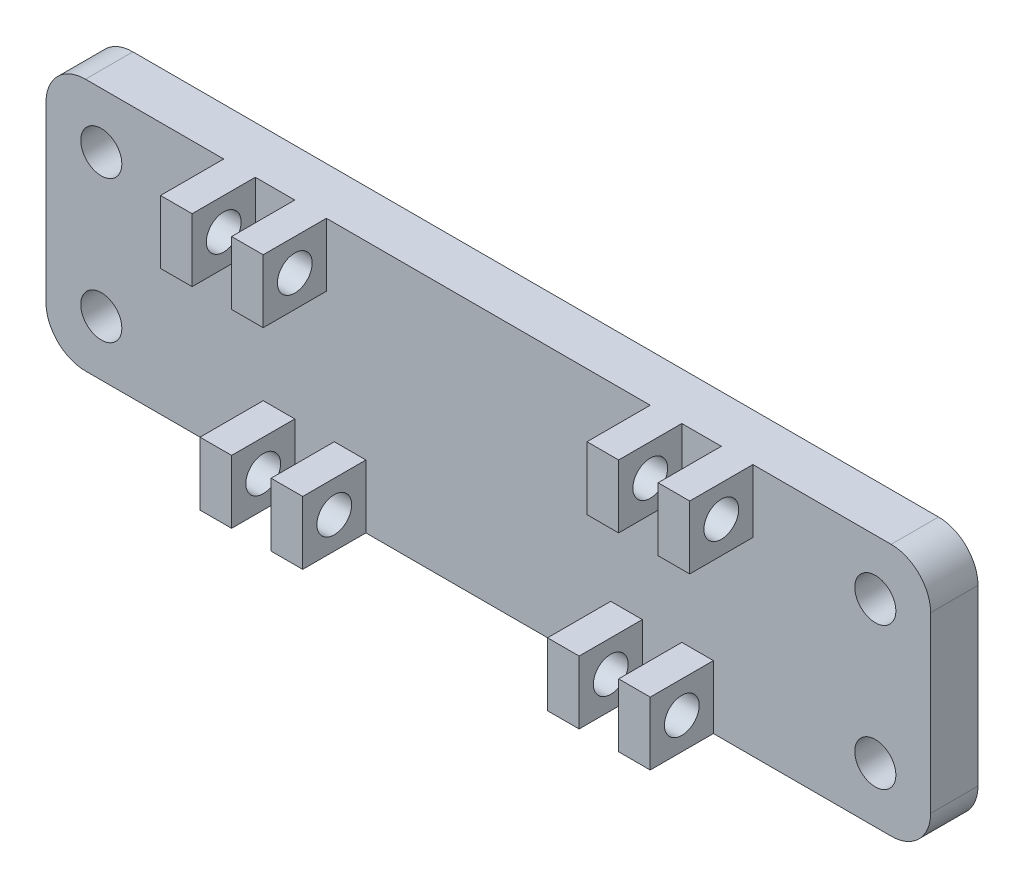
from build123d import *

# Parameters (mm, degrees)
SKETCH_2_R          = 1.3
EXTRUDE_2_DEPTH     = 3
SKETCH_4_W          = 2
SKETCH_4_H          = 4
EXTRUDE_3_DEPTH     = 4
SKETCH_6_R          = 1.1
CUT_EXTRUDE_2_DEPTH = 47.987365323


with BuildPart() as part:
    # 草图2 → 凸台-拉伸2 (new body)
    with BuildSketch(Plane.XY):
        with BuildLine():
            Line((52.5, -10), (52.5, 1))
            ThreePointArc((52.5, 1), (51.767766953, 2.767766953), (50, 3.5))
            Line((50, 3.5), (-1, 3.5))
            ThreePointArc((-1, 3.5), (-2.767766953, 2.767766953), (-3.5, 1))
            Line((-3.5, 1), (-3.5, -10))
            ThreePointArc((-3.5, -10), (-2.767766953, -11.767766953), (-1, -12.5))
            Line((-1, -12.5), (50, -12.5))
            ThreePointArc((50, -12.5), (51.767766953, -11.767766953), (52.5, -10))
        make_face()
        with Locations((0, -9)):
            Circle(SKETCH_2_R, mode=Mode.SUBTRACT)
        with Locations((49, -9)):
            Circle(SKETCH_2_R, mode=Mode.SUBTRACT)
        with Locations((49, 0)):
            Circle(SKETCH_2_R, mode=Mode.SUBTRACT)
        Circle(SKETCH_2_R, mode=Mode.SUBTRACT)
    extrude(amount=EXTRUDE_2_DEPTH)

    # 草图4 → 凸台-拉伸3 (add)
    with BuildSketch(Plane.XY.offset(3)):
        with Locations((8.75, 1.5)):
            Rectangle(SKETCH_4_W, SKETCH_4_H)
        with Locations((11.25, -10.5)):
            Rectangle(SKETCH_4_W, SKETCH_4_H)
        with Locations((13.25, 1.5)):
            Rectangle(SKETCH_4_W, SKETCH_4_H)
        with Locations((15.75, -10.5)):
            Rectangle(SKETCH_4_W, SKETCH_4_H)
        with Locations((35.75, 1.5)):
            Rectangle(SKETCH_4_W, SKETCH_4_H)
        with Locations((33.25, -10.5)):
            Rectangle(SKETCH_4_W, SKETCH_4_H)
        with Locations((40.25, 1.5)):
            Rectangle(SKETCH_4_W, SKETCH_4_H)
        with Locations((37.75, -10.5)):
            Rectangle(SKETCH_4_W, SKETCH_4_H)
    extrude(amount=EXTRUDE_3_DEPTH)

    # 草图6 → 切除-拉伸2 (cut, through all)
    with BuildSketch(Plane.ZY.offset(-7.75)):
        with Locations((5, 1.5)):
            Circle(SKETCH_6_R)
        with Locations((5, -10.5)):
            Circle(SKETCH_6_R)
    extrude(amount=-CUT_EXTRUDE_2_DEPTH, mode=Mode.SUBTRACT)


solid = part.part
